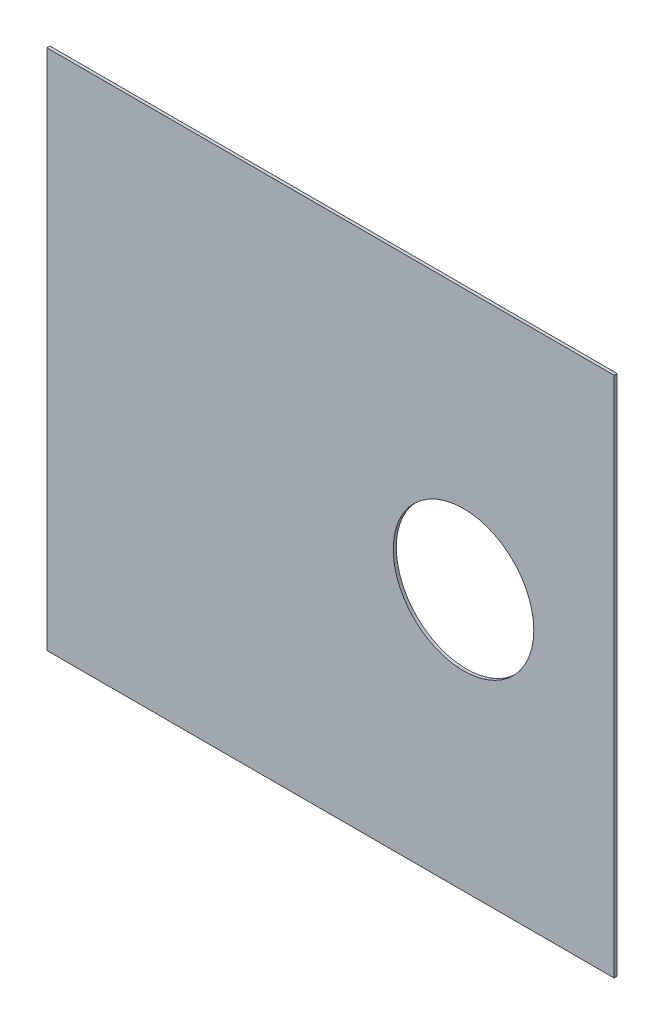
from build123d import *

# Parameters (mm, degrees)
SKICA1_W                = 565
SKICA1_H                = 520
SKICA1_R                = 70
P_IDAT_VYSUNUT_M1_DEPTH = 3


with BuildPart() as part:
    # Skica1 → Přidat vysunutím1 (new body)
    with BuildSketch(Plane.XY):
        Rectangle(SKICA1_W, SKICA1_H)
        with Locations((132.5, 0)):
            Circle(SKICA1_R, mode=Mode.SUBTRACT)
    extrude(amount=P_IDAT_VYSUNUT_M1_DEPTH)


solid = part.part
